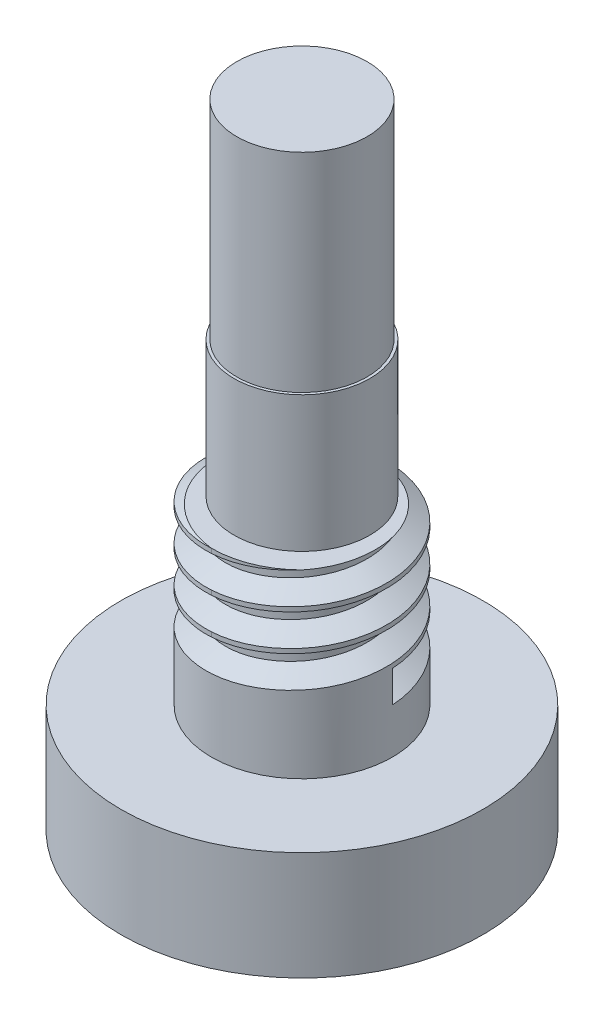
from build123d import *

# Parameters (mm, degrees)
SKETCH1_R           = 2.286
BOSS_EXTRUDE1_DEPTH = 7.3025
SKETCH2_R           = 2.38252
BOSS_EXTRUDE2_DEPTH = 4.762246
SKETCH3_R           = 3.175
BOSS_EXTRUDE3_DEPTH = 3.175
SKETCH4_R           = 3.175
BOSS_EXTRUDE4_DEPTH = 3.175
THREAD2_PITCH       = 1.27
SKETCH11_R          = 6.35
BOSS_EXTRUDE5_DEPTH = 3.81


with BuildPart() as part:
    # Sketch1 → Boss-Extrude1 (new body)
    with BuildSketch(Plane(origin=(0, 0, 0), x_dir=(1, 0, 0), z_dir=(0, 1, 0))):
        with Locations(Location((0, 0, 0), (0, 0, 90))):
            Circle(SKETCH1_R)
    extrude(amount=BOSS_EXTRUDE1_DEPTH)

    # Sketch2 → Boss-Extrude2 (add)
    with BuildSketch(Plane(origin=(0, 0, 0), x_dir=(-1, 0, 0), z_dir=(0, -1, 0))):
        with Locations(Location((0, 0, 0), (0, 0, 90))):
            Circle(SKETCH2_R)
    extrude(amount=BOSS_EXTRUDE2_DEPTH)

    # Sketch3 → Boss-Extrude3 (add)
    with BuildSketch(Plane(origin=(0, -4.762246, 0), x_dir=(-1, 0, 0), z_dir=(0, -1, 0))):
        with Locations(Location((0, 0, 0), (0, 0, 90))):
            Circle(SKETCH3_R)
    extrude(amount=BOSS_EXTRUDE3_DEPTH)

    # Sketch4 → Boss-Extrude4 (add)
    with BuildSketch(Plane(origin=(0, -7.937246, 0), x_dir=(-1, 0, 0), z_dir=(0, -1, 0))):
        with Locations(Location((0, 0, 0), (0, 0, 90))):
            Circle(SKETCH4_R)
    extrude(amount=BOSS_EXTRUDE4_DEPTH)

    # Thread2: the profile of Thread Profile3 profile screwed along a right-hand helix of 3.75 turns, 8 arcs to a turn; built about Z, then put on its axis
    thread2_z = Axis((0, 0, 0), (0, 0, 1))
    thread2_corners = [(3.1753, 0, -0.000173205), (3.1753, 0, 1.111423202), (2.487592339, 0, 0.714374998), (2.487592339, 0, 0.396874998)]
    with BuildLine(mode=Mode.PRIVATE) as thread2_profile:
        Line(thread2_corners[0], thread2_corners[1])
        Line(thread2_corners[1], thread2_corners[2])
        Line(thread2_corners[2], thread2_corners[3])
        Line(thread2_corners[3], thread2_corners[0])
    thread2_cap = Face(thread2_profile.wire())
    thread2_turn_angles = [0, 22.5, 45, 67.5, 90, 112.5, 135, 157.5, 180, 202.5, 225, 247.5, 270, 292.5, 315, 337.5, 360]
    thread2_turn_weights = [1, 0.9238795325112867, 1, 0.9238795325112867, 1, 0.9238795325112867, 1, 0.9238795325112867, 1, 0.9238795325112867, 1, 0.9238795325112867, 1, 0.9238795325112867, 1, 0.9238795325112867, 1]
    thread2_turn_rails = [Edge.make_bspline([Vector(p[0], p[1], 0).rotate(thread2_z, thread2_turn_angles[k]) / thread2_turn_weights[k] + Vector(0, 0, p[2] + THREAD2_PITCH * thread2_turn_angles[k] / 360) for k in range(17)], [0, 0, 0, 1, 1, 2, 2, 3, 3, 4, 4, 5, 5, 6, 6, 7, 7, 8, 8, 8], 2, thread2_turn_weights) for p in thread2_corners]
    thread2_turn_sides = [Face.make_surface_from_curves(thread2_turn_rails[p[0]], thread2_turn_rails[p[1]]) for p in [(0, 1), (1, 2), (2, 3), (3, 0)]]
    thread2_last_angles = [1080, 1102.5, 1125, 1147.5, 1170, 1192.5, 1215, 1237.5, 1260, 1282.5, 1305, 1327.5, 1350]
    thread2_last_weights = [1, 0.9238795325112867, 1, 0.9238795325112867, 1, 0.9238795325112867, 1, 0.9238795325112867, 1, 0.9238795325112867, 1, 0.9238795325112883, 1]
    thread2_last_rails = [Edge.make_bspline([Vector(p[0], p[1], 0).rotate(thread2_z, thread2_last_angles[k]) / thread2_last_weights[k] + Vector(0, 0, p[2] + THREAD2_PITCH * thread2_last_angles[k] / 360) for k in range(13)], [0, 0, 0, 1, 1, 2, 2, 3, 3, 4, 4, 5, 5, 6, 6, 6], 2, thread2_last_weights) for p in thread2_corners]
    thread2_last_sides = [Face.make_surface_from_curves(thread2_last_rails[p[0]], thread2_last_rails[p[1]]) for p in [(0, 1), (1, 2), (2, 3), (3, 0)]]
    thread2 = Plane(origin=(0, -9.524746, 0), x_dir=(1, 0, 0), z_dir=(0, 1, 0)) * Solid(Shell([*[p.moved(Location((0, 0, THREAD2_PITCH * i))) for i in range(3) for p in thread2_turn_sides], *thread2_last_sides, thread2_cap, thread2_cap.rotate(thread2_z, 1350).moved(Location((0, 0, THREAD2_PITCH * 1350 / 360)))]))
    add(thread2, mode=Mode.SUBTRACT)

    # Sketch11 → Boss-Extrude5 (add)
    with BuildSketch(Plane(origin=(0, -11.112246, 0), x_dir=(-1, 0, 0), z_dir=(0, -1, 0))):
        with Locations(Location((0, 0, 0), (0, 0, 270))):
            Circle(SKETCH11_R)
    extrude(amount=BOSS_EXTRUDE5_DEPTH)


solid = part.part
